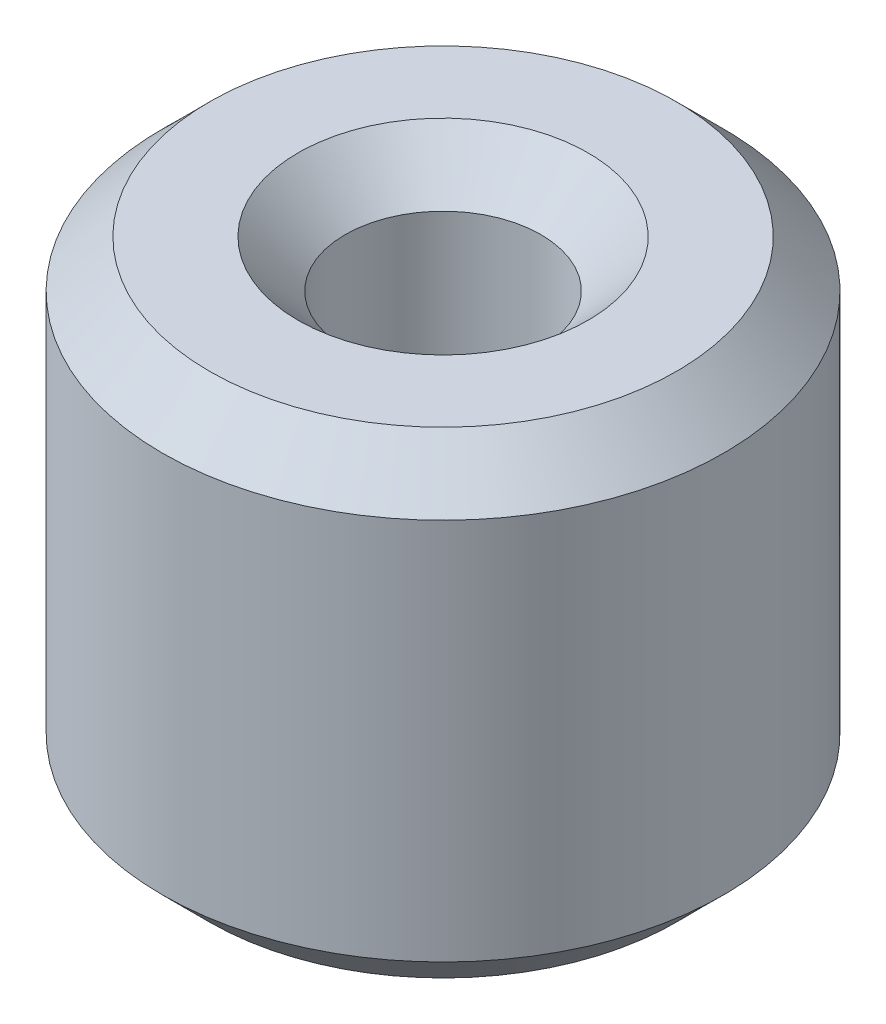
from build123d import *

# Parameters (mm, degrees)
SKETCH1_R           = 12.5
BOSS_EXTRUDE1_DEPTH = 21.24125873
SKETCH2_R           = 4.357752611
CUT_EXTRUDE1_DEPTH  = 28.634961054
CHAMFER1_SIZE       = 2.101893155


with BuildPart() as part:
    # Sketch1 → Boss-Extrude1 (new body)
    with BuildSketch(Plane(origin=(0, 0, 0), x_dir=(1, 0, 0), z_dir=(0, 1, 0))):
        Circle(SKETCH1_R)
    extrude(amount=BOSS_EXTRUDE1_DEPTH)

    # Sketch2 → Cut-Extrude1 (cut, through all)
    with BuildSketch(Plane(origin=(0, 0, 0), x_dir=(1, 0, 0), z_dir=(0, 1, 0))):
        Circle(SKETCH2_R)
    extrude(amount=CUT_EXTRUDE1_DEPTH, mode=Mode.SUBTRACT)

    # Chamfer1
    chamfer1_edges = [part.edges().sort_by_distance(p)[0] for p in [
        (-4.357752611, 21.24125873, 0),
        (-4.357752611, 0, 0),
        (-12.5, 0, 0),
        (-12.5, 21.24125873, 0),
    ]]
    chamfer(chamfer1_edges, length=CHAMFER1_SIZE)


solid = part.part
